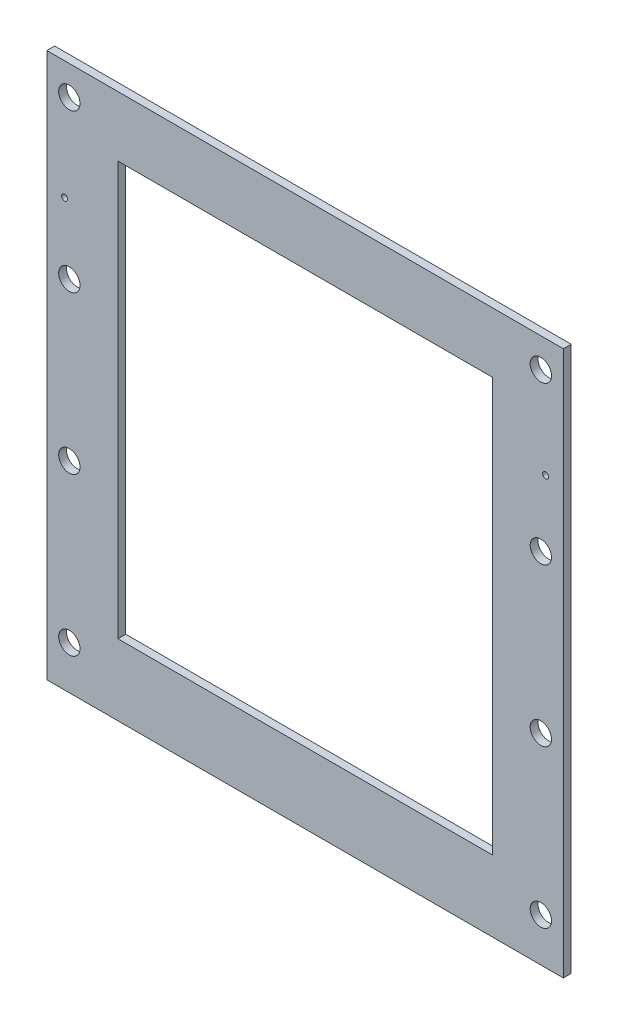
from build123d import *

# Parameters (mm, degrees)
SKETCH1_R           = 4.5
SKETCH1_R_2         = 1.25
SKETCH1_W           = 158
SKETCH1_H           = 174.6
BOSS_EXTRUDE1_DEPTH = 3.302


with BuildPart() as part:
    # Sketch1 → Boss-Extrude1 (new body)
    with BuildSketch(Plane.XY):
        Polygon((81.884816754, 109.882198953), (81.884816754, -120.117801047), (-136.115183246, -120.117801047), (-136.115183246, 109.882198953), (-106.115183246, 109.882198953), (51.884816754, 109.882198953), align=None)
        with Locations((-126.615183246, 97.482198953)):
            Circle(SKETCH1_R, mode=Mode.SUBTRACT)
        with Locations((72.384816754, 97.482198953)):
            Circle(SKETCH1_R, mode=Mode.SUBTRACT)
        with Locations((-128.615183246, 59.882198953)):
            Circle(SKETCH1_R_2, mode=Mode.SUBTRACT)
        with Locations((74.384816754, 59.882198953)):
            Circle(SKETCH1_R_2, mode=Mode.SUBTRACT)
        with Locations((-126.615183246, 31.062198953)):
            Circle(SKETCH1_R, mode=Mode.SUBTRACT)
        with Locations((72.384816754, 31.062198953)):
            Circle(SKETCH1_R, mode=Mode.SUBTRACT)
        with Locations((-126.615183246, -35.357801047)):
            Circle(SKETCH1_R, mode=Mode.SUBTRACT)
        with Locations((72.384816754, -35.357801047)):
            Circle(SKETCH1_R, mode=Mode.SUBTRACT)
        with Locations((-126.615183246, -101.777801047)):
            Circle(SKETCH1_R, mode=Mode.SUBTRACT)
        with Locations((72.384816754, -101.777801047)):
            Circle(SKETCH1_R, mode=Mode.SUBTRACT)
        with Locations((-27.115183246, -2.817801047)):
            Rectangle(SKETCH1_W, SKETCH1_H, mode=Mode.SUBTRACT)
    extrude(amount=BOSS_EXTRUDE1_DEPTH)


solid = part.part
